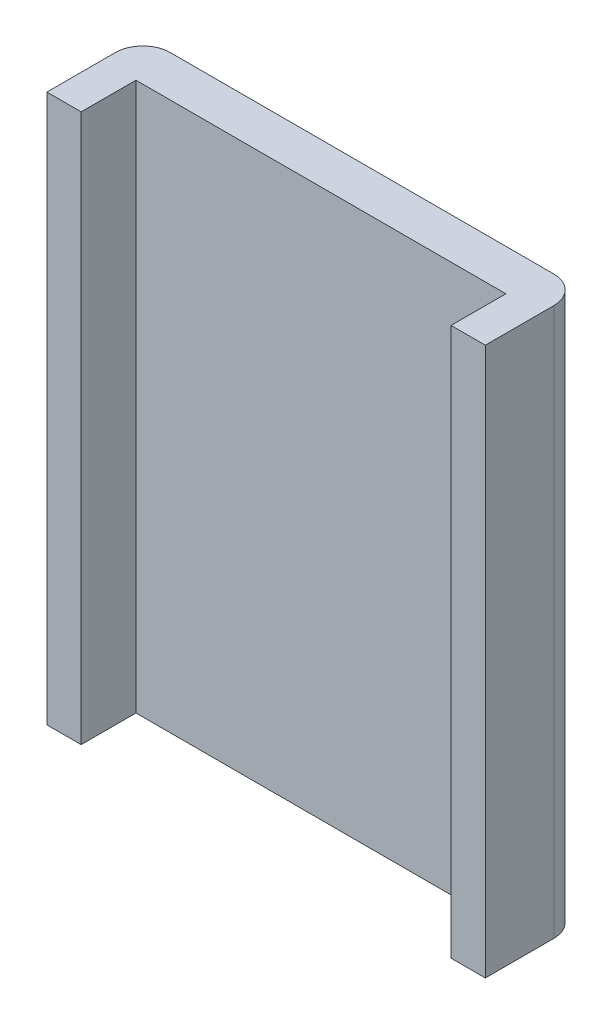
from build123d import *

# Parameters (mm, degrees)
SKETCH1_W           = 6.75
SKETCH1_H           = 10
BOSS_EXTRUDE1_DEPTH = 0.75
SKETCH1_3_W         = 0.625
SKETCH1_3_H         = 10
BOSS_EXTRUDE2_DEPTH = 1.75
FILLET1_R           = 0.5


with BuildPart() as part:
    # Sketch1 → Boss-Extrude1 (new body)
    with BuildSketch(Plane.XY):
        Rectangle(SKETCH1_W, SKETCH1_H)
    extrude(amount=BOSS_EXTRUDE1_DEPTH)

    # Sketch1<3> → Boss-Extrude2 (add)
    with BuildSketch(Plane.XY):
        with Locations((-3.6875, 0)):
            Rectangle(SKETCH1_3_W, SKETCH1_3_H)
        with Locations((3.6875, 0)):
            Rectangle(SKETCH1_3_W, SKETCH1_3_H)
    extrude(amount=BOSS_EXTRUDE2_DEPTH)

    # Fillet1
    fillet1_edges = [part.edges().sort_by_distance(p)[0] for p in [
        (-4, 0, 0),
        (4, 0, 0),
    ]]
    fillet(fillet1_edges, radius=FILLET1_R)


solid = part.part
